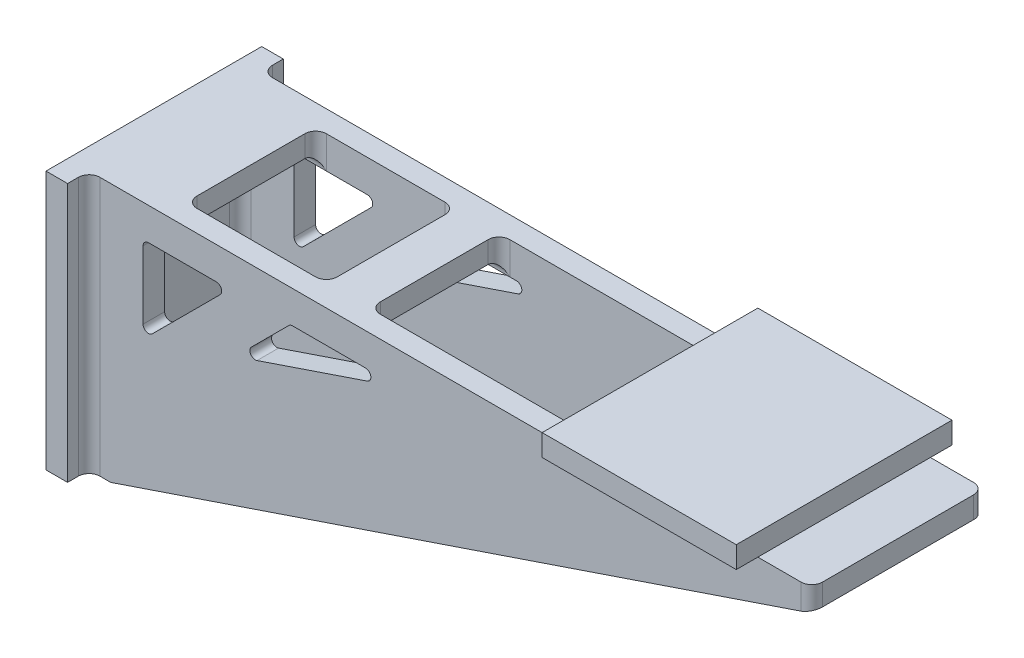
from build123d import *

# Parameters (mm, degrees)
BASE_SKETCH_W            = 254
BASE_SKETCH_H            = 304.8
BASE_DEPTH               = 25.4
RIGHT_TRIANGLE_DEPTH     = 25.4
LEFT_TRIANGLE_DEPTH      = 25.4
SUPPORT_BEAMS_SKETCH_W   = 114.3
SUPPORT_BEAMS_SKETCH_H   = 203.2
SUPPORT_BEAMS_SKETCH_W_2 = 50.8
SUPPORT_BEAMS_SKETCH_W_3 = 88.9
SUPPORT_BEAMS_DEPTH      = 25.4
FILLET1_R                = 12.7
TOP_PLATE_SKETCH_W       = 228.6
TOP_PLATE_SKETCH_H       = 254
TOP_PLATE_DEPTH          = 25.4
FILLET4_R                = 2.54
CUT_EXTRUDE1_DEPTH       = 923.91521279
FILLET6_R                = 6.35


with BuildPart() as part:
    # Base Sketch → Base (new body)
    with BuildSketch(Plane(origin=(0, 0, 0), x_dir=(0, 0, -1), z_dir=(1, 0, 0))):
        Rectangle(BASE_SKETCH_W, BASE_SKETCH_H)
    extrude(amount=BASE_DEPTH)

    # Right Triangle Sketch → Right Triangle (add)
    with BuildSketch(Plane.XY.offset(101.6)):
        Polygon((0, 152.4), (876.3, 152.4), (876.3, 127), (50.8, -152.4), (0, -152.4), align=None)
    extrude(amount=-RIGHT_TRIANGLE_DEPTH)

    # Left Triangle Sketch → Left Triangle (add)
    with BuildSketch(Plane(origin=(0, 0, -101.6), x_dir=(-1, 0, 0), z_dir=(0, 0, -1))):
        Polygon((0, 152.4), (-876.3, 152.4), (-876.3, 127), (-50.8, -152.4), (0, -152.4), align=None)
    extrude(amount=-LEFT_TRIANGLE_DEPTH)

    # Support Beams Sketch → Support Beams (add)
    with BuildSketch(Plane(origin=(0, 152.4, 0), x_dir=(1, 0, 0), z_dir=(0, 1, 0))):
        with Locations((57.15, 0)):
            Rectangle(SUPPORT_BEAMS_SKETCH_W, SUPPORT_BEAMS_SKETCH_H)
        with Locations((304.8, 0)):
            Rectangle(SUPPORT_BEAMS_SKETCH_W_2, SUPPORT_BEAMS_SKETCH_H)
        with Locations((831.85, 0)):
            Rectangle(SUPPORT_BEAMS_SKETCH_W_3, SUPPORT_BEAMS_SKETCH_H)
    extrude(amount=-SUPPORT_BEAMS_DEPTH)

    # Fillet1
    fillet1_edges = [part.edges().sort_by_distance(p)[0] for p in [
        (25.4, 0, -101.6),
        (25.4, 0, 101.6),
        (25.4, -12.7, -76.2),
        (69.85, 127, -76.2),
        (25.4, 127, 0),
        (25.4, -12.7, 76.2),
        (69.85, 127, 76.2),
        (304.8, 127, 76.2),
        (304.8, 127, -76.2),
        (831.85, 127, -76.2),
        (831.85, 127, 76.2),
        (787.4, 139.7, 76.2),
        (787.4, 139.7, -76.2),
        (279.4, 139.7, 76.2),
        (279.4, 139.7, -76.2),
        (330.2, 139.7, -76.2),
        (330.2, 139.7, 76.2),
        (114.3, 139.7, 76.2),
        (114.3, 139.7, -76.2),
        (876.3, 139.7, -101.6),
        (876.3, 139.7, 101.6),
    ]]
    fillet(fillet1_edges, radius=FILLET1_R)

    # Top Plate Sketch → Top Plate (add)
    with BuildSketch(Plane(origin=(0, 152.4, 0), x_dir=(1, 0, 0), z_dir=(0, 1, 0))):
        with Locations((698.5, 0)):
            Rectangle(TOP_PLATE_SKETCH_W, TOP_PLATE_SKETCH_H)
    extrude(amount=TOP_PLATE_DEPTH)

    # Fillet4
    fillet4_edges = [part.edges().sort_by_distance(p)[0] for p in [
        (679.45, 152.4, -76.2),
        (783.680256121, 152.4, -72.480256121),
        (679.45, 152.4, 76.2),
        (783.680256121, 152.4, 72.480256121),
        (787.4, 152.4, 0),
    ]]
    fillet(fillet4_edges, radius=FILLET4_R)

    # Sketch1 → Cut-Extrude1 (cut, through all)
    with BuildSketch(Plane.XY.offset(101.6)):
        Polygon((88.9, 12.7), (88.9, 114.3), (190.5, 114.3), align=None)
        Polygon((197.365304783, 49.323255814), (262.342048969, 114.3), (389.342048969, 114.3), align=None)
    extrude(amount=-CUT_EXTRUDE1_DEPTH, mode=Mode.SUBTRACT)

    # Fillet6
    fillet6_edges = [part.edges().sort_by_distance(p)[0] for p in [
        (389.342048969, 114.3, -88.9),
        (262.342048969, 114.3, -88.9),
        (197.365304783, 49.323255814, -88.9),
        (190.5, 114.3, -88.9),
        (88.9, 12.7, -88.9),
        (88.9, 114.3, -88.9),
        (88.9, 114.3, 88.9),
        (88.9, 12.7, 88.9),
        (190.5, 114.3, 88.9),
        (197.365304783, 49.323255814, 88.9),
        (262.342048969, 114.3, 88.9),
        (389.342048969, 114.3, 88.9),
    ]]
    fillet(fillet6_edges, radius=FILLET6_R)


solid = part.part
